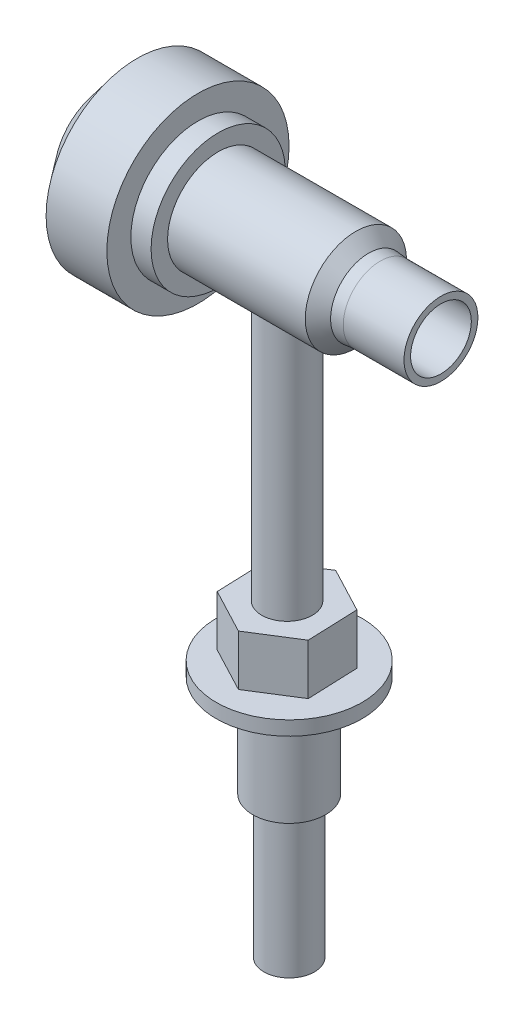
from build123d import *

# Parameters (mm, degrees)
SKETCH1_R            = 25
BOSS_EXTRUDE1_DEPTH  = 60
SKETCH2_R            = 20
BOSS_EXTRUDE3_DEPTH  = 20
BOSS_EXTRUDE3_TAPER  = 5
CHAMFER1_SIZE        = 13
CHAMFER1_SIZE_2      = 14.300817279
SKETCH3_R            = 18.250226729
SKETCH3_R_2          = 15
BOSS_EXTRUDE5_DEPTH  = 30
SKETCH4_R            = 12.5
BOSS_EXTRUDE6_DEPTH  = 150
SKETCH7_R            = 33.146308187
SKETCH7_R_2          = 25
BOSS_EXTRUDE11_DEPTH = 10
SKETCH8_R            = 45
BOSS_EXTRUDE12_DEPTH = 30
CUT_EXTRUDE1_DEPTH   = 5
BOSS_EXTRUDE13_DEPTH = 25
SKETCH14_R           = 36
BOSS_EXTRUDE14_DEPTH = 7
SKETCH15_R           = 18
BOSS_EXTRUDE15_DEPTH = 50
SKETCH16_R           = 12.5
BOSS_EXTRUDE16_DEPTH = 70
FILLET1_R            = 3
FILLET2_R            = 3


# Read off the part's stored shape, not the designer's step: Boundary1
with BuildPart() as part:
    # Sketch1 → Boss-Extrude1 (new body)
    with BuildSketch(Plane(origin=(0, 0, 0), x_dir=(0, 0, -1), z_dir=(1, 0, 0))):
        with Locations(Location((0, 0, 0), (0, 0, 180))):
            Circle(SKETCH1_R)
    extrude(amount=BOSS_EXTRUDE1_DEPTH)

    # Sketch2 → Boss-Extrude3 (add)
    with BuildSketch(Plane(origin=(60, 0, 0), x_dir=(0, 0, -1), z_dir=(1, 0, 0))):
        Circle(SKETCH2_R)
    extrude(amount=BOSS_EXTRUDE3_DEPTH, taper=BOSS_EXTRUDE3_TAPER)

    # Chamfer1
    # the kernel refuses this chamfer: 14.300817279, 13 mm, written as the material it adds along each edge
    with BuildSketch(Plane(origin=(60, 0, 0), x_dir=(0, 0, -1), z_dir=(0, -1, 0))) as chamfer1_piece_1_section:
        Polygon((20 + CHAMFER1_SIZE, 0), (20 - CHAMFER1_SIZE_2 * 0.0871557427485, CHAMFER1_SIZE_2 * 0.996194698102), (20, 0), align=None)
    chamfer1_piece_1 = revolve(axis=Axis((60, 0, 0), (1, 0, 0)), mode=Mode.PRIVATE)
    chamfer1_piece_1 = chamfer1_piece_1 & Plane(origin=(71.177617688, 0, 0), x_dir=(0, 0, 1), z_dir=(-1, 0, 0)) * Cylinder(25, 132, mode=Mode.PRIVATE)
    add(chamfer1_piece_1)

    # Sketch3 → Boss-Extrude5 (add)
    with BuildSketch(Plane(origin=(80, 0, 0), x_dir=(0, 0, -1), z_dir=(1, 0, 0))):
        Circle(SKETCH3_R)
        Circle(SKETCH3_R_2, mode=Mode.SUBTRACT)
    extrude(amount=BOSS_EXTRUDE5_DEPTH)

    # Sketch4 → Boss-Extrude6 (add)
    with BuildSketch(Plane(origin=(0, 0, 0), x_dir=(1, 0, 0), z_dir=(0, 1, 0))):
        with Locations(Location((34, 0, 0), (0, 0, 270))):
            Circle(SKETCH4_R)
    extrude(amount=-BOSS_EXTRUDE6_DEPTH)

    # Sketch13 → Boss-Extrude13 (add)
    with BuildSketch(Plane.XZ.offset(150)):
        Polygon((33.039636823, -24.981547241), (55.154472948, -13.322472529), (56.114836125, 11.659074712), (34.960363177, 24.981547241), (12.845527052, 13.322472529), (11.885163875, -11.659074712), align=None)
    extrude(amount=BOSS_EXTRUDE13_DEPTH)

    # Sketch14 → Boss-Extrude14 (add)
    with BuildSketch(Plane.XZ.offset(175)):
        with Locations(Location((35.056399495, 0, 0), (0, 0, 270))):
            Circle(SKETCH14_R)
    extrude(amount=BOSS_EXTRUDE14_DEPTH)

    # Sketch15 → Boss-Extrude15 (add)
    with BuildSketch(Plane.XZ.offset(182)):
        with Locations(Location((35.056399495, 0, 0), (0, 0, 270))):
            Circle(SKETCH15_R)
    extrude(amount=BOSS_EXTRUDE15_DEPTH)

    # Sketch16 → Boss-Extrude16 (add)
    with BuildSketch(Plane.XZ.offset(232)):
        with Locations(Location((35.056399495, 0, 0), (0, 0, 270))):
            Circle(SKETCH16_R)
    extrude(amount=BOSS_EXTRUDE16_DEPTH)

    # Fillet1
    fillet1_edges = [part.edges().sort_by_distance(p)[0] for p in [
        (35.056399495, -232, 12.5),
    ]]
    fillet(fillet1_edges, radius=FILLET1_R)

    # Fillet2
    fillet2_edges = [part.edges().sort_by_distance(p)[0] for p in [
        (35.056399495, -182, 18),
    ]]
    fillet(fillet2_edges, radius=FILLET2_R)


with BuildPart() as body_2:
    # Sketch7 → Boss-Extrude11 (new body)
    with BuildSketch(Plane.ZY):
        Circle(SKETCH7_R)
        Circle(SKETCH7_R_2, mode=Mode.SUBTRACT)
    extrude(amount=BOSS_EXTRUDE11_DEPTH)

    # Sketch8 → Boss-Extrude12 (add)
    with BuildSketch(Plane.ZY.offset(10)):
        Circle(SKETCH8_R)
    extrude(amount=BOSS_EXTRUDE12_DEPTH)

    # Boundary1 outline → Boundary1 (revolve)
    with BuildSketch(Plane.YX):
        Polygon((0, -56), (24.873571566, -56), (45, -40), (0, -40), align=None)
    revolve(axis=Axis((0, 0, 0), (1, 0, 0)))

    # Sketch11 → Cut-Extrude1 (cut)
    with BuildSketch(Plane.ZY.offset(56)):
        with BuildLine():
            Line((6.132563907, 3.930969814), (-1.714402502, -1.098930983))
            Line((-1.714402502, -1.098930983), (3.548302536, -6.361636021))
            ThreePointArc((3.548302536, -6.361636021), (6.281230942, -3.68876695), (7.28428883, 0))
            ThreePointArc((7.28428883, 0), (6.990430263, 2.048108516), (6.132563907, 3.930969814))
        make_face()
    extrude(amount=-CUT_EXTRUDE1_DEPTH, mode=Mode.SUBTRACT)


solid = Compound([part.part, body_2.part])
